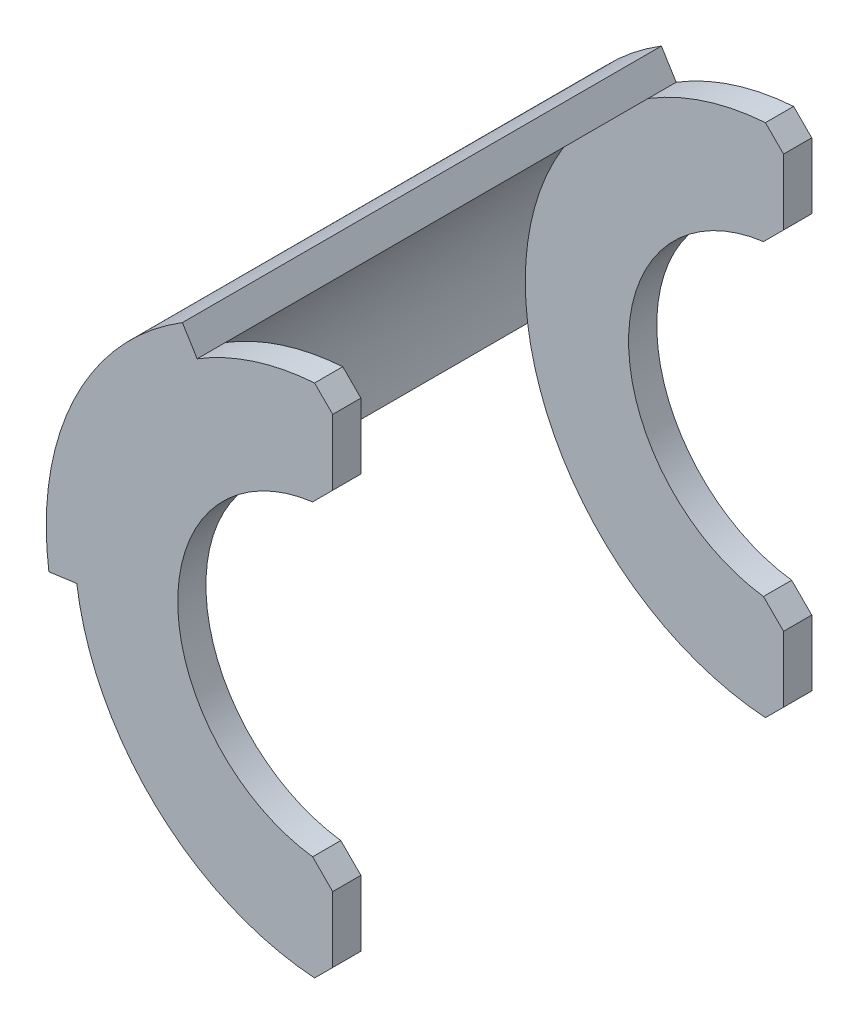
from build123d import *

# Parameters (mm, degrees)
BASE_FLANGE1_DEPTH  = 3
BOSS_EXTRUDE1_DEPTH = 51
BASE_FLANGE2_START  = -3
BASE_FLANGE2_DEPTH  = 3
CHAMFER1_SIZE       = 2
CHAMFER2_SIZE       = 2


# Sheet-metal steps are written as plain solids
with BuildPart() as part:
    # Base-Flange1: sheet metal written as solids
    # Sketch1 → Base-Flange1 (new body)
    with BuildSketch(Plane.XY):
        with BuildLine():
            Line((0, 27.5), (0, 16.5))
            ThreePointArc((0, 16.5), (-16.5, 0), (0, -16.5))
            Line((0, -16.5), (0, -27.5))
            ThreePointArc((0, -27.5), (-27.5, 0), (0, 27.5))
        make_face()
    extrude(amount=-BASE_FLANGE1_DEPTH)

    # Sketch6 → Boss-Extrude1 (add)
    with BuildSketch(Plane.XY):
        with BuildLine():
            Line((-14.431370788, 23.409090909), (-16.005702146, 25.962809917))
            ThreePointArc((-16.005702146, 25.962809917), (-27.576558365, 13.030097036), (-30.220353458, -4.120708299))
            Line((-30.220353458, -4.120708299), (-27.247859675, -3.715392728))
            ThreePointArc((-27.247859675, -3.715392728), (-24.864110001, 11.748448147), (-14.431370788, 23.409090909))
        make_face()
    extrude(amount=-BOSS_EXTRUDE1_DEPTH)

    # Chamfer1
    # the kernel refuses this chamfer: 2 mm, written as the material it takes off along each edge
    with BuildSketch(Plane(origin=(0, 27.5, 5.143365976), x_dir=(0, -1, 0), z_dir=(0, 0, -1))) as chamfer1_piece_1:
        with BuildLine():
            Line((CHAMFER1_SIZE, 0), (0.06795314, 1.93204686))
            ThreePointArc((0.06795314, 1.93204686), (0.017965239, 0.993863861), (0, 0))
            Line((0, 0), (CHAMFER1_SIZE, 0))
        make_face()
    extrude(amount=13.286731952, mode=Mode.SUBTRACT)
    with BuildSketch(Plane(origin=(0, 16.5, 5.511382139), x_dir=(-0.9978876375482535, -0.06496354999817457, 0), z_dir=(0, 0, -1))) as chamfer1_piece_2:
        with BuildLine():
            Line((2.14379715, 0), (-CHAMFER1_SIZE * 0.0649635499982, CHAMFER1_SIZE * 0.997887637548))
            Line((-CHAMFER1_SIZE * 0.0649635499982, CHAMFER1_SIZE * 0.997887637548), (0, 0))
            ThreePointArc((0, 0), (1.102072489, 0.034826391), (2.14379715, 0))
        make_face()
    extrude(amount=14.022764278, mode=Mode.SUBTRACT)
    with BuildSketch(Plane(origin=(0, -16.5, 5.511382139), x_dir=(0, -1, 0), z_dir=(0, 0, -1))) as chamfer1_piece_3:
        with BuildLine():
            Line((CHAMFER1_SIZE, 0), (-0.139268673, 2.139268673))
            ThreePointArc((-0.139268673, 2.139268673), (-0.036841717, 1.102006958), (0, 0))
            Line((0, 0), (CHAMFER1_SIZE, 0))
        make_face()
    extrude(amount=14.022764278, mode=Mode.SUBTRACT)
    with BuildSketch(Plane(origin=(0, -27.5, 5.143365976), x_dir=(0, 1, 0), z_dir=(0, 0, -1))) as chamfer1_piece_4:
        with BuildLine():
            Line((CHAMFER1_SIZE, 0), (0.06795314, -1.93204686))
            ThreePointArc((0.06795314, -1.93204686), (0.017965239, -0.993863861), (0, 0))
            Line((0, 0), (CHAMFER1_SIZE, 0))
        make_face()
    extrude(amount=13.286731952, mode=Mode.SUBTRACT)


with BuildPart() as body_2:
    # Base-Flange2: sheet metal written as solids
    # Sketch7 → Base-Flange2 (new body)
    with BuildSketch(Plane(origin=(0, 0, -51), x_dir=(-1, 0, 0), z_dir=(0, 0, -1)).offset(BASE_FLANGE2_START)):
        with BuildLine():
            Line((0, 27.5), (0, 16.5))
            ThreePointArc((0, 16.5), (16.5, 0), (0, -16.5))
            Line((0, -16.5), (0, -27.5))
            ThreePointArc((0, -27.5), (27.5, 0), (0, 27.5))
        make_face()
    extrude(amount=BASE_FLANGE2_DEPTH)

    # Chamfer2
    # the kernel refuses this chamfer: 2 mm, written as the material it takes off along each edge
    with BuildSketch(Plane(origin=(0, -27.5, -42.856634024), x_dir=(0, 1, 0), z_dir=(0, 0, -1))) as chamfer2_piece_1:
        with BuildLine():
            Line((CHAMFER2_SIZE, 0), (0.06795314, -1.93204686))
            ThreePointArc((0.06795314, -1.93204686), (0.017965239, -0.993863861), (0, 0))
            Line((0, 0), (CHAMFER2_SIZE, 0))
        make_face()
    extrude(amount=13.286731952, mode=Mode.SUBTRACT)
    with BuildSketch(Plane(origin=(0, -16.5, -42.488617861), x_dir=(-0.9978876375482537, 0.06496354999817457, 0), z_dir=(0, 0, -1))) as chamfer2_piece_2:
        with BuildLine():
            Line((2.14379715, 0), (-CHAMFER2_SIZE * 0.0649635499982, -CHAMFER2_SIZE * 0.997887637548))
            Line((-CHAMFER2_SIZE * 0.0649635499982, -CHAMFER2_SIZE * 0.997887637548), (0, 0))
            ThreePointArc((0, 0), (1.102072489, -0.034826391), (2.14379715, 0))
        make_face()
    extrude(amount=14.022764278, mode=Mode.SUBTRACT)
    with BuildSketch(Plane(origin=(0, 16.5, -42.488617861), x_dir=(0, 1, 0), z_dir=(0, 0, -1))) as chamfer2_piece_3:
        with BuildLine():
            Line((CHAMFER2_SIZE, 0), (-0.139268673, -2.139268673))
            ThreePointArc((-0.139268673, -2.139268673), (-0.036841717, -1.102006958), (0, 0))
            Line((0, 0), (CHAMFER2_SIZE, 0))
        make_face()
    extrude(amount=14.022764278, mode=Mode.SUBTRACT)
    with BuildSketch(Plane(origin=(0, 27.5, -42.856634024), x_dir=(0, -1, 0), z_dir=(0, 0, -1))) as chamfer2_piece_4:
        with BuildLine():
            Line((CHAMFER2_SIZE, 0), (0.06795314, 1.93204686))
            ThreePointArc((0.06795314, 1.93204686), (0.017965239, 0.993863861), (0, 0))
            Line((0, 0), (CHAMFER2_SIZE, 0))
        make_face()
    extrude(amount=13.286731952, mode=Mode.SUBTRACT)


solid = Compound([part.part, body_2.part])
